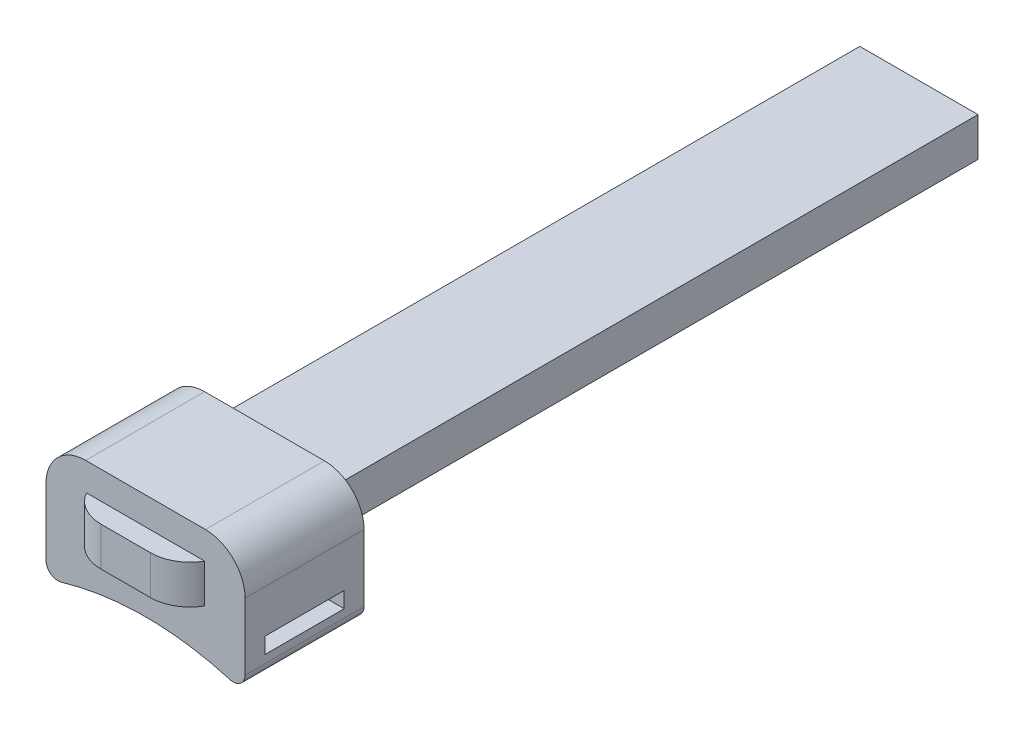
from build123d import *

# Parameters (mm, degrees)
BOSS_EXTRUDE1_DEPTH = 200
SKETCH2_W           = 29.8
SKETCH2_H           = 9.8
BOSS_EXTRUDE2_DEPTH = 30
FILLET1_R           = 10
FILLET2_R           = 10
CUT_EXTRUDE1_DEPTH  = 56


with BuildPart() as part:
    # Sketch1 → Boss-Extrude1 (new body)
    with BuildSketch(Plane.XY):
        Polygon((0, 0), (14.9, 0), (14.9, 9.8), (-14.9, 9.8), (-14.9, 0), align=None)
    extrude(amount=-BOSS_EXTRUDE1_DEPTH)

    # Sketch2 → Boss-Extrude2 (add)
    with BuildSketch(Plane.XY.offset(-5)):
        with BuildLine():
            ThreePointArc((-25.1, -10), (-24.221320344, -12.121320344), (-22.1, -13))
            ThreePointArc((-22.1, -13), (-21.670577963, -12.969107057), (-21.25, -12.877064476))
            ThreePointArc((-21.25, -12.877064476), (0, -9.80367638), (21.25, -12.877064476))
            ThreePointArc((21.25, -12.877064476), (21.670577963, -12.969107057), (22.1, -13))
            ThreePointArc((22.1, -13), (24.221320344, -12.121320344), (25.1, -10))
            Line((25.1, -10), (25.1, 6.8))
            ThreePointArc((25.1, 6.8), (22.171067812, 13.871067812), (15.1, 16.8))
            Line((15.1, 16.8), (-14.9, 16.8))
            Line((-14.9, 16.8), (-15.1, 16.8))
            ThreePointArc((-15.1, 16.8), (-22.171067812, 13.871067812), (-25.1, 6.8))
            Line((-25.1, 6.8), (-25.1, -10))
        make_face()
        with Locations((0, 4.9)):
            Rectangle(SKETCH2_W, SKETCH2_H, mode=Mode.SUBTRACT)
    extrude(amount=-BOSS_EXTRUDE2_DEPTH)

    # Fillet1
    # the kernel refuses this fillet: 10 mm, written as the material it takes off along each edge
    with BuildSketch(Plane(origin=(14.9, -21.650635095, 0), x_dir=(0, 0, -1), z_dir=(0, 1, 0))) as fillet1_piece_1:
        with BuildLine():
            CenterArc((10, 8.660254038), FILLET1_R, 180, 60)
            Line((0, 8.660254038), (-0.2, 8.660254038))
            Line((-0.2, 8.660254038), (-0.2, 0))
            Line((-0.2, 0), (0, -0.2))
            ThreePointArc((0, -0.2), (2.5, -0.2), (4.9, -0.173205081))
            Line((4.9, -0.173205081), (5, 0))
        make_face()
    extrude(amount=53.101270189, mode=Mode.SUBTRACT)

    # Fillet2
    # the kernel refuses this fillet: 10 mm, written as the material it takes off along each edge
    with BuildSketch(Plane(origin=(-14.9, 31.450635095, 0), x_dir=(1, 0, 0), z_dir=(0, -1, 0))) as fillet2_piece_1:
        with BuildLine():
            CenterArc((8.660254038, -10), FILLET2_R, 90, 60)
            Line((0, -5), (-0.173205081, -4.9))
            ThreePointArc((-0.173205081, -4.9), (-0.2, -2.5), (-0.2, 0))
            Line((-0.2, 0), (0, 0.2))
            Line((0, 0.2), (8.660254038, 0.2))
            Line((8.660254038, 0.2), (8.660254038, 0))
        make_face()
    extrude(amount=53.101270189, mode=Mode.SUBTRACT)

    # Sketch3 → Cut-Extrude1 (cut)
    with BuildSketch(Plane(origin=(25.1, 0, 0), x_dir=(0, 0, -1), z_dir=(1, 0, 0))):
        Polygon((30, -4), (30, -8), (20, -8), (10, -8), (10, -4), align=None)
    extrude(amount=-CUT_EXTRUDE1_DEPTH, mode=Mode.SUBTRACT)


solid = part.part
